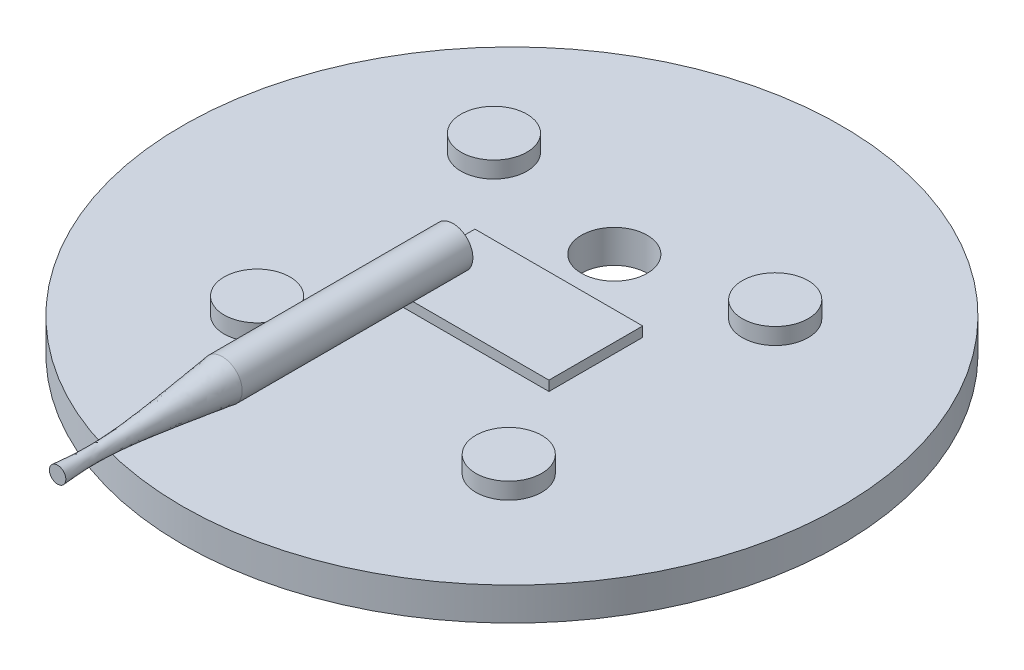
from build123d import *

# Parameters (mm, degrees)
SKETCH_1_R          = 100
EXTRUDE_1_DEPTH     = 10
SKETCH_3_W          = 50.90867769
SKETCH_3_H          = 28.448966944
EXTRUDE_2_DEPTH     = 3
SKETCH_4_R          = 10
CUT_EXTRUDE_1_DEPTH = 13
SKETCH_5_R          = 10
EXTRUDE_3_DEPTH     = 5
SKETCH_6_R          = 6
EXTRUDE_5_DEPTH     = 70


with BuildPart() as part:
    # 草图1 → 凸台-拉伸1 (new body)
    with BuildSketch(Plane(origin=(0, 0, 0), x_dir=(1, 0, 0), z_dir=(0, 1, 0))):
        with Locations(Location((0, 0, 0), (0, 0, 270))):
            Circle(SKETCH_1_R)
    extrude(amount=-EXTRUDE_1_DEPTH)

    # 草图3 → 凸台-拉伸2 (add)
    with BuildSketch(Plane(origin=(0, 0, 0), x_dir=(1, 0, 0), z_dir=(0, 1, 0))):
        Rectangle(SKETCH_3_W, SKETCH_3_H)
    extrude(amount=EXTRUDE_2_DEPTH)

    # 草图4 → 切除-拉伸1 (cut)
    with BuildSketch(Plane(origin=(0, 0, 0), x_dir=(1, 0, 0), z_dir=(0, 1, 0))):
        with Locations(Location((-0.694974251, 31.764448054, 0), (0, 0, 270))):
            Circle(SKETCH_4_R)
    extrude(amount=-CUT_EXTRUDE_1_DEPTH, mode=Mode.SUBTRACT)

    # 草图5 → 凸台-拉伸3 (add)
    with BuildSketch(Plane(origin=(0, 0, 0), x_dir=(1, 0, 0), z_dir=(0, 1, 0))):
        with Locations(Location((40.855283356, -41.817842388, 0), (0, 0, 270))):
            Circle(SKETCH_5_R)
        with Locations(Location((-38.930165292, -38.395410274, 0), (0, 0, 270))):
            Circle(SKETCH_5_R)
        with Locations(Location((-45.775029519, 40.320528338, 0), (0, 0, 270))):
            Circle(SKETCH_5_R)
        with Locations(Location((40.641381349, 39.251018302, 0), (0, 0, 270))):
            Circle(SKETCH_5_R)
    extrude(amount=EXTRUDE_3_DEPTH)


with BuildPart() as body_2:
    # 草图6 → 凸台-拉伸5 (new body)
    with BuildSketch(Plane.XY):
        with Locations((-17.851094774, 9.381785608)):
            Circle(SKETCH_6_R)
    extrude(amount=EXTRUDE_5_DEPTH)

    # 放样1: read off the stored shape, not the designer's step
    # 放样1: loft between two sections, ruled curve by curve
    loft_1_from = [
        Edge.make_bspline([(-11.973474879, 8.17613874, 70), (-9.562181143, 19.93137853, 70), (-21.317420933, 22.342672266, 70), (-23.728714669, 10.587432476, 70), (-26.140008405, -1.167807313, 70), (-14.384768615, -3.57910105, 70), (-11.973474879, 8.17613874, 70)], [0, 0, 0, 0, 0.5, 0.5, 0.5, 1, 1, 1, 1], 3, [1, 0.333333333, 0.333333333, 1, 0.333333333, 0.333333333, 1]),
    ]
    loft_1_to = [
        Edge.make_bspline([(-19.036161622, 7.180509486, 120), (-14.633609377, 4.810375791, 120), (-12.263475682, 9.212928036, 120), (-16.666027927, 11.583061731, 120), (-21.068580172, 13.953195426, 120), (-23.438713866, 9.550643181, 120), (-19.036161622, 7.180509486, 120)], [0, 0, 0, 0, 0.5, 0.5, 0.5, 1, 1, 1, 1], 3, [1, 0.333333333, 0.333333333, 1, 0.333333333, 0.333333333, 1]),
    ]
    loft_1 = Solid(Shell([*[Face.make_surface_from_curves(loft_1_from[k], loft_1_to[k]) for k in range(1)], Face(Wire(loft_1_from)), Face(Wire(loft_1_to))]))
    add(loft_1)


solid = Compound([part.part, body_2.part])
